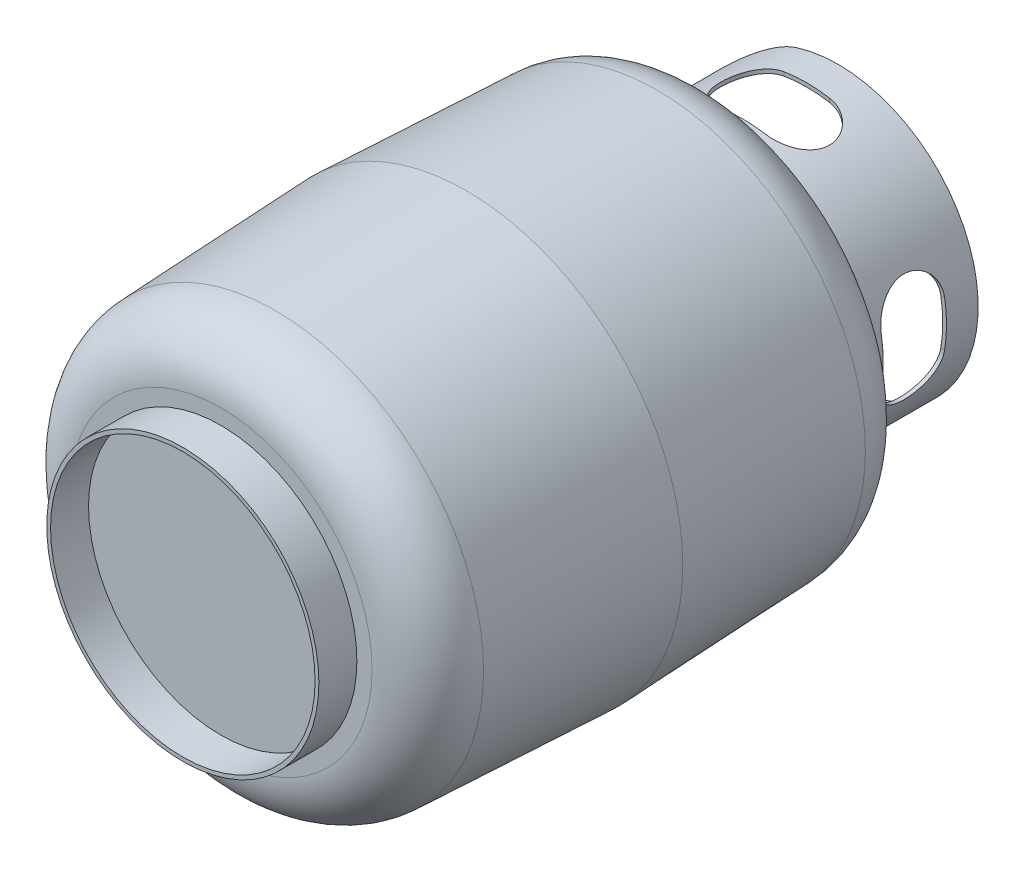
from build123d import *

# Parameters (mm, degrees)
BOSS_EXTRUDE1_DEPTH     = 100
CUT_EXTRUDE3_DEPTH      = 545.160288675
CUT_EXTRUDE4_DEPTH      = 545.160288764
CUT_EXTRUDE4_DEPTH_BACK = 545.160288764
CUT_EXTRUDE5_DEPTH      = 545.160288764
CUT_EXTRUDE5_DEPTH_BACK = 545.160288764
BOSS_EXTRUDE2_START     = 30
SKETCH13_R              = 107.421871599
SKETCH13_R_2            = 104.421871599
BOSS_EXTRUDE2_DEPTH     = 30


# Read off the part's stored shape, not the designer's step: Shell1
with BuildPart() as part:
    # Sketch1 → Revolve2 (revolve)
    with BuildSketch(Plane(origin=(0, 0, 0), x_dir=(1, 0, 0), z_dir=(0, 1, 0))):
        with BuildLine():
            Line((0, 0), (119.421871599, 0))
            ThreePointArc((119.421871599, 0), (150.539959109, 12.493621707), (164.37904157, 43.037127569))
            Line((164.37904157, 43.037127569), (170.959307689, 193.75))
            Line((170.959307689, 193.75), (164.37904157, 344.462872431))
            ThreePointArc((164.37904157, 344.462872431), (150.539959109, 375.006378293), (119.421871599, 387.5))
            Line((119.421871599, 387.5), (37, 387.5))
            ThreePointArc((37, 387.5), (28.514718626, 391.014718626), (25, 399.5))
            Line((25, 399.5), (25, 407.5))
            Line((25, 407.5), (0, 407.5))
            Line((0, 407.5), (0, 0))
        make_face()
    revolve(axis=Axis((0, 0, 0), (0, 0, -1)))

    # Shell1 outline → Shell1 (revolve, cut)
    with BuildSketch(Plane.XZ):
        with BuildLine():
            Line((0, -407.5), (21, -407.5))
            Line((21, -407.5), (21, -399.5))
            ThreePointArc((21, -399.5), (25.686291501, -388.186291501), (37, -383.5))
            Line((37, -383.5), (119.421871599, -383.5))
            ThreePointArc((119.421871599, -383.5), (147.773906886, -372.116922444), (160.382848683, -344.288394882))
            Line((160.382848683, -344.288394882), (166.955496948, -193.75))
            Line((166.955496948, -193.75), (160.382848683, -43.211605118))
            ThreePointArc((160.382848683, -43.211605118), (147.773906886, -15.383077556), (119.421871599, -4))
            Line((119.421871599, -4), (0, -4))
            Line((0, -4), (0, -407.5))
        make_face()
    revolve(axis=Axis((0, 0, 0), (0, 0, 1)), mode=Mode.SUBTRACT)

    # Sketch2 → Boss-Extrude1 (add)
    with BuildSketch(Plane(origin=(0, 0, -387.5), x_dir=(-1, 0, 0), z_dir=(0, 0, -1))):
        with BuildLine():
            Line((63.335383607, 90.452301854), (61.614654298, 87.994845721))
            ThreePointArc((61.614654298, 87.994845721), (-107.421871599, 0), (61.614654298, -87.994845721))
            Line((61.614654298, -87.994845721), (63.335383607, -90.452301854))
            ThreePointArc((63.335383607, -90.452301854), (-110.421871599, 0), (63.335383607, 90.452301854))
        make_face()
    extrude(amount=BOSS_EXTRUDE1_DEPTH)

    # Sketch7 → Cut-Extrude3 (cut, through all)
    with BuildSketch(Plane(origin=(0, 0, 0), x_dir=(0, 0, -1), z_dir=(1, 0, 0))):
        with BuildLine():
            Line((412.5, -18), (412.5, 18))
            ThreePointArc((412.5, 18), (437.5, 43), (462.5, 18))
            Line((462.5, 18), (462.5, -18))
            ThreePointArc((462.5, -18), (437.5, -43), (412.5, -18))
        make_face()
    extrude(amount=CUT_EXTRUDE3_DEPTH, mode=Mode.SUBTRACT)

    # Sketch10 → Cut-Extrude4 (cut, two sides: drawn at the far end of the back side and taken through both)
    with BuildSketch(Plane(origin=(0, 0, 0), x_dir=(1, 0, 0), z_dir=(0, 1, 0)).offset(-CUT_EXTRUDE4_DEPTH_BACK)):
        with BuildLine():
            Line((-18, 462.5), (18, 462.5))
            ThreePointArc((18, 462.5), (43, 437.5), (18, 412.5))
            Line((18, 412.5), (-18, 412.5))
            ThreePointArc((-18, 412.5), (-43, 437.5), (-18, 462.5))
        make_face()
    extrude(amount=CUT_EXTRUDE4_DEPTH + CUT_EXTRUDE4_DEPTH_BACK, mode=Mode.SUBTRACT)

    # Sketch12 → Cut-Extrude5 (cut, two sides: drawn at the far end of the back side and taken through both)
    with BuildSketch(Plane(origin=(0, 0, 0), x_dir=(1, 0, 0), z_dir=(0, 1, 0)).offset(-CUT_EXTRUDE5_DEPTH_BACK)):
        with BuildLine():
            Line((-63.335383607, 457.5), (-63.335383607, 487.5))
            Line((-63.335383607, 487.5), (-33.335383607, 487.5))
            ThreePointArc((-33.335383607, 487.5), (-54.548587042, 478.713203436), (-63.335383607, 457.5))
        make_face()
    extrude(amount=CUT_EXTRUDE5_DEPTH + CUT_EXTRUDE5_DEPTH_BACK, mode=Mode.SUBTRACT)

    # Sketch13 → Boss-Extrude2 (add)
    with BuildSketch(Plane.XY.offset(BOSS_EXTRUDE2_START)):
        Circle(SKETCH13_R)
        Circle(SKETCH13_R_2, mode=Mode.SUBTRACT)
    extrude(amount=-BOSS_EXTRUDE2_DEPTH)


solid = part.part
